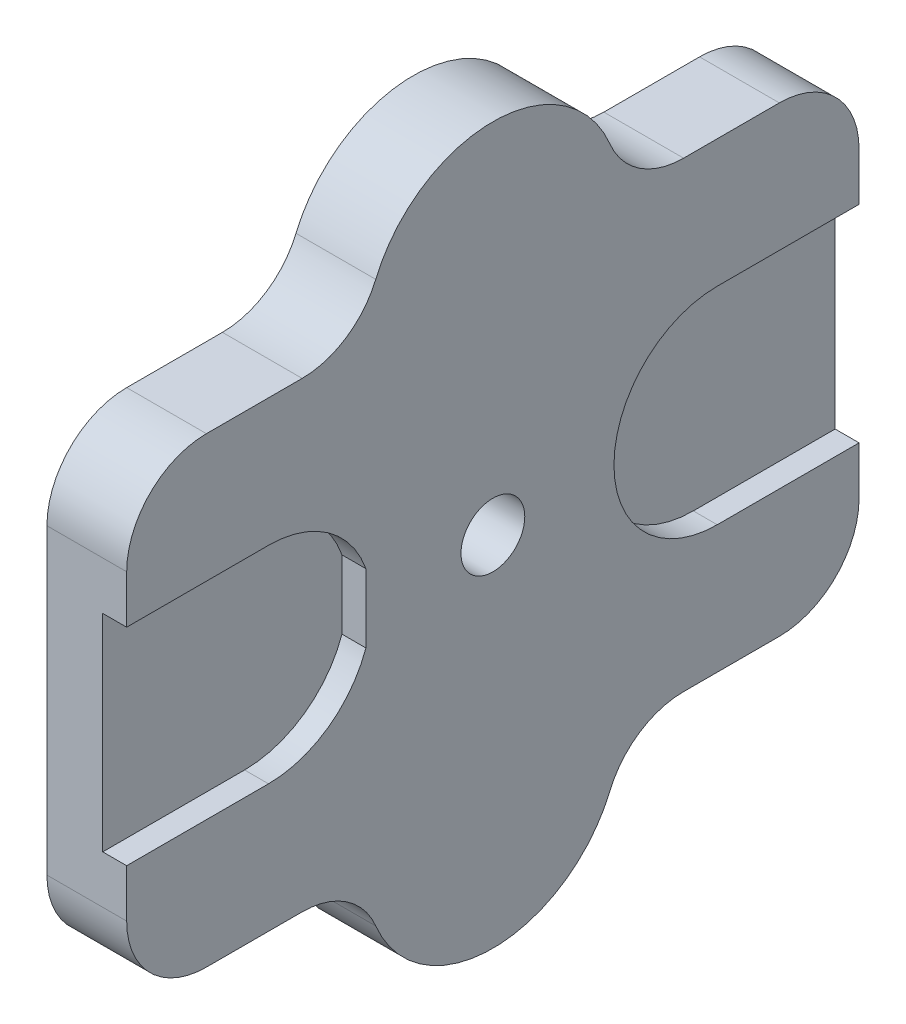
from build123d import *

# Parameters (mm, degrees)
BOSS_EXTRUDE3_DEPTH = 10
SKETCH3_R           = 4
CUT_EXTRUDE3_DEPTH  = 14.0462
CUT_EXTRUDE4_DEPTH  = 3


with BuildPart() as part:
    # Sketch1 → Boss-Extrude3 (new body)
    with BuildSketch(Plane.YZ):
        with BuildLine():
            Line((-28.968617751, -12.789334175), (28.968617751, -12.789334175))
            ThreePointArc((28.968617751, -12.789334175), (44.579120821, 0), (35.110840206, 17.821518929))
            ThreePointArc((35.110840206, 17.821518929), (30.644623053, 21.505675602), (28.968617751, 27.047436358))
            Line((28.968617751, 27.047436358), (28.968617751, 39.053986921))
            ThreePointArc((28.968617751, 39.053986921), (26.039685563, 46.125054733), (18.968617751, 49.053986921))
            Line((18.968617751, 49.053986921), (-18.968617751, 49.053986921))
            ThreePointArc((-18.968617751, 49.053986921), (-26.039685563, 46.125054733), (-28.968617751, 39.053986921))
            Line((-28.968617751, 39.053986921), (-28.968617751, 27.047436358))
            ThreePointArc((-28.968617751, 27.047436358), (-30.644623053, 21.505675602), (-35.110840206, 17.821518929))
            ThreePointArc((-35.110840206, 17.821518929), (-44.579120821, 0), (-28.968617751, -12.789334175))
        make_face()
    boss_extrude3 = extrude(amount=BOSS_EXTRUDE3_DEPTH)

    # Sketch3 → Cut-Extrude3 (cut)
    with BuildSketch(Plane.YZ.offset(10)):
        with Locations((0, 3.132326373)):
            Circle(SKETCH3_R)
    cut_extrude3 = extrude(amount=-CUT_EXTRUDE3_DEPTH, mode=Mode.SUBTRACT)

    # Sketch4 → Cut-Extrude4 (cut)
    with BuildSketch(Plane.YZ.offset(10)):
        with BuildLine():
            Line((-12.95, 49.053986921), (-12.95, 31.267703884))
            ThreePointArc((-12.95, 31.267703884), (0, 18.317703884), (12.95, 31.267703884))
            Line((12.95, 31.267703884), (12.95, 49.053986921))
            Line((12.95, 49.053986921), (-12.95, 49.053986921))
        make_face()
    cut_extrude4 = extrude(amount=-CUT_EXTRUDE4_DEPTH, mode=Mode.SUBTRACT)

    # Mirror1: Boss-Extrude3, Cut-Extrude3, Cut-Extrude4 across plane
    add(boss_extrude3.mirror(Plane.XY.offset(3.132326373)))
    add(cut_extrude3.mirror(Plane.XY.offset(3.132326373)), mode=Mode.SUBTRACT)
    add(cut_extrude4.mirror(Plane.XY.offset(3.132326373)), mode=Mode.SUBTRACT)


solid = part.part
